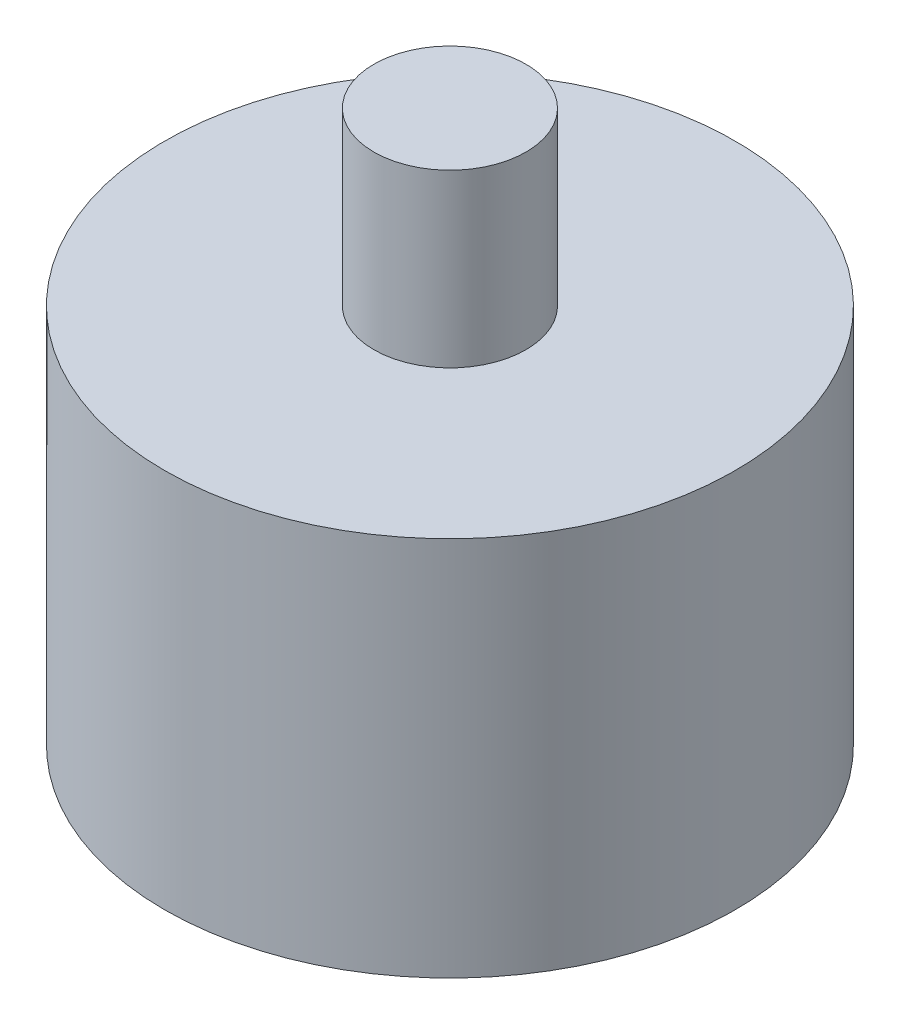
from build123d import *

# Parameters (mm, degrees)
SKETCH1_R           = 15
BOSS_EXTRUDE1_DEPTH = 20
SKETCH2_R           = 4
BOSS_EXTRUDE2_DEPTH = 9


with BuildPart() as part:
    # Sketch1 → Boss-Extrude1 (new body)
    with BuildSketch(Plane(origin=(0, 0, 0), x_dir=(1, 0, 0), z_dir=(0, 1, 0))):
        Circle(SKETCH1_R)
    extrude(amount=BOSS_EXTRUDE1_DEPTH)

    # Sketch2 → Boss-Extrude2 (add)
    with BuildSketch(Plane(origin=(0, 20, 0), x_dir=(1, 0, 0), z_dir=(0, 1, 0))):
        Circle(SKETCH2_R)
    extrude(amount=BOSS_EXTRUDE2_DEPTH)


solid = part.part
